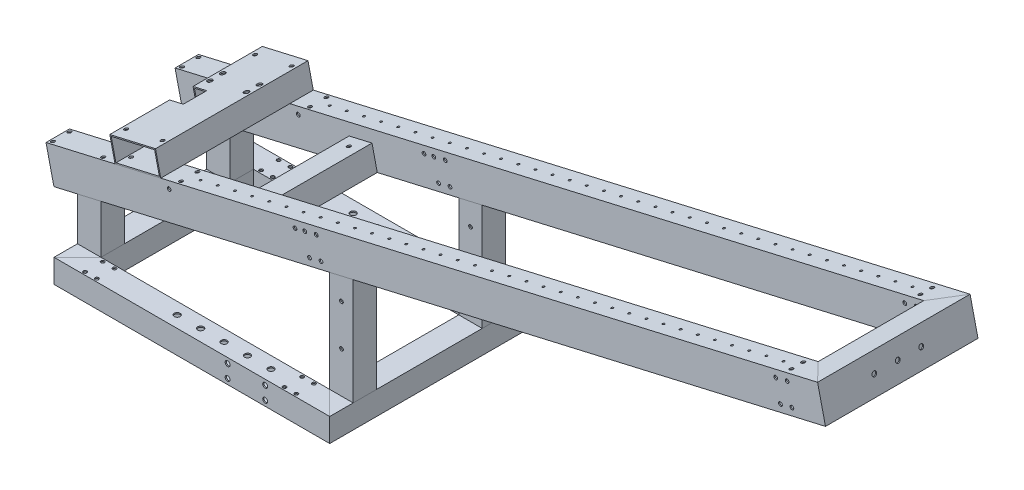
from build123d import *

# Parameters (mm, degrees)
F_20_X_20_X_2_1_DEPTH      = 165.142135624
F_20_X_20_X_2_1_DEPTH_BACK = 15.142135624
SKETCH1_W                  = 20
SKETCH1_H                  = 20
SKETCH1_W_2                = 18
SKETCH1_H_2                = 18
SKETCH1_ON_SEGMENT_2_W     = 20
SKETCH1_ON_SEGMENT_2_H     = 20
SKETCH1_ON_SEGMENT_2_W_2   = 18
SKETCH1_ON_SEGMENT_2_H_2   = 18
F_20_X_20_X_2_1_2_DEPTH    = 245.284271247
SKETCH1_ON_SEGMENT_3_W     = 20
SKETCH1_ON_SEGMENT_3_H     = 20
SKETCH1_ON_SEGMENT_3_W_2   = 18
SKETCH1_ON_SEGMENT_3_H_2   = 18
F_20_X_20_X_2_1_3_DEPTH    = 180.284271247
SKETCH1_ON_SEGMENT_4_W     = 20
SKETCH1_ON_SEGMENT_4_H     = 20
SKETCH1_ON_SEGMENT_4_W_2   = 18
SKETCH1_ON_SEGMENT_4_H_2   = 18
F_20_X_20_X_2_1_4_DEPTH    = 245.284271247
SKETCH1_ON_SEGMENT_5_W     = 20
SKETCH1_ON_SEGMENT_5_H     = 20
SKETCH1_ON_SEGMENT_5_W_2   = 18
SKETCH1_ON_SEGMENT_5_H_2   = 18
F_20_X_20_X_2_1_5_DEPTH    = 65.463338908
SKETCH1_ON_SEGMENT_6_W     = 20
SKETCH1_ON_SEGMENT_6_H     = 20
SKETCH1_ON_SEGMENT_6_W_2   = 18
SKETCH1_ON_SEGMENT_6_H_2   = 18
F_20_X_20_X_2_1_6_DEPTH    = 115.1
SKETCH1_ON_SEGMENT_7_W     = 20
SKETCH1_ON_SEGMENT_7_H     = 20
SKETCH1_ON_SEGMENT_7_W_2   = 18
SKETCH1_ON_SEGMENT_7_H_2   = 18
F_20_X_20_X_2_1_7_DEPTH    = 115.1
SKETCH1_ON_SEGMENT_8_W     = 20
SKETCH1_ON_SEGMENT_8_H     = 20
SKETCH1_ON_SEGMENT_8_W_2   = 18
SKETCH1_ON_SEGMENT_8_H_2   = 18
F_20_X_20_X_2_1_8_DEPTH    = 65.463338908
SKETCH12_W                 = 30
SKETCH12_H                 = 20
SKETCH12_W_2               = 28
SKETCH12_H_2               = 18
F_20_X_20_X_2_22_DEPTH     = 684.027756377
SKETCH12_ON_SEGMENT_2_W    = 30
SKETCH12_ON_SEGMENT_2_H    = 20
SKETCH12_ON_SEGMENT_2_W_2  = 28
SKETCH12_ON_SEGMENT_2_H_2  = 18
F_20_X_20_X_2_22_2_DEPTH   = 148.055512755
SKETCH12_ON_SEGMENT_3_W    = 30
SKETCH12_ON_SEGMENT_3_H    = 20
SKETCH12_ON_SEGMENT_3_W_2  = 28
SKETCH12_ON_SEGMENT_3_H_2  = 18
F_20_X_20_X_2_22_3_DEPTH   = 684.027756377
CUT_EXTRUDE_1_REACH        = 700.493
SKETCH_4_R                 = 2
SKETCH_5_R                 = 1.6
SKETCH_5_R_2               = 1
CUT_EXTRUDE_2_DEPTH        = 30
CUT_EXTRUDE_START          = -20
SKETCH_6_R                 = 1.5
CUT_EXTRUDE_3_DEPTH        = 20
EXTRUDE_1_DEPTH            = 90
SKETCH_15_R                = 1.6
CUT_EXTRUDE_9_DEPTH        = 683.795673711
SKETCH_16_R                = 1.6
EXTRUDE_5_DEPTH            = 20
CUT_EXTRUDE_10_DEPTH       = 683.795673711
SKETCH_19_R                = 1.6
CUT_EXTRUDE_11_DEPTH       = 668.222784448
SKETCH_21_R                = 2.1
CUT_EXTRUDE_16_DEPTH       = 688.466313384
SKETCH_22_R                = 1.6
CUT_EXTRUDE_17_DEPTH       = 683.795673711
SKETCH_23_R                = 2.5
CUT_EXTRUDE_18_DEPTH       = 20
SKETCH_26_R                = 2.1
CUT_EXTRUDE_19_DEPTH       = 668.515789659
SKETCH_27_R                = 1.6
CUT_EXTRUDE_20_DEPTH       = 683.795673711


with BuildPart() as part:
    # Sketch1 → 方形管 20 X 20 X 2(1) (new, two sides: drawn at the far end of the back side and taken through both)
    with BuildSketch(Plane.XY.offset(-75).offset(-F_20_X_20_X_2_1_DEPTH_BACK)):
        Rectangle(SKETCH1_W, SKETCH1_H)
        Rectangle(SKETCH1_W_2, SKETCH1_H_2, mode=Mode.SUBTRACT)
    extrude(amount=F_20_X_20_X_2_1_DEPTH + F_20_X_20_X_2_1_DEPTH_BACK)

    # 方形管 20 X 20 X 2(1) mitre 1
    split(bisect_by=Plane(origin=(0, 0, -75), x_dir=(0, -1, 0), z_dir=(-0.707106781, 0, 0.707106781)), keep=Keep.TOP)

    # 方形管 20 X 20 X 2(1) mitre 2
    split(bisect_by=Plane(origin=(0, 0, 75), x_dir=(0, -1, 0), z_dir=(-0.707106781, 0, -0.707106781)), keep=Keep.TOP)


with BuildPart() as body_2:
    # Sketch1 on segment 2 (carried to segment 2) → 20 X 20 X 2_1 2 (new body)
    with BuildSketch(Plane(origin=(-15.142135624, 0, 75), x_dir=(0, 0, -1), z_dir=(1, 0, 0))):
        Rectangle(SKETCH1_ON_SEGMENT_2_W, SKETCH1_ON_SEGMENT_2_H)
        Rectangle(SKETCH1_ON_SEGMENT_2_W_2, SKETCH1_ON_SEGMENT_2_H_2, mode=Mode.SUBTRACT)
    extrude(amount=F_20_X_20_X_2_1_2_DEPTH)

    # 20 X 20 X 2_1 2 mitre 1
    split(bisect_by=Plane(origin=(0, 0, 75), x_dir=(0, 1, 0), z_dir=(0.707106781, 0, 0.707106781)), keep=Keep.TOP)

    # 20 X 20 X 2_1 2 mitre 2
    split(bisect_by=Plane(origin=(215, 0, 75), x_dir=(0, -1, 0), z_dir=(-0.707106781, 0, 0.707106781)), keep=Keep.TOP)


with BuildPart() as body_3:
    # Sketch1 on segment 3 (carried to segment 3) → 20 X 20 X 2_1 3 (new body)
    with BuildSketch(Plane(origin=(215, 0, 90.142135624), x_dir=(-1, 0, 0), z_dir=(0, 0, -1))):
        Rectangle(SKETCH1_ON_SEGMENT_3_W, SKETCH1_ON_SEGMENT_3_H)
        Rectangle(SKETCH1_ON_SEGMENT_3_W_2, SKETCH1_ON_SEGMENT_3_H_2, mode=Mode.SUBTRACT)
    extrude(amount=F_20_X_20_X_2_1_3_DEPTH)

    # 20 X 20 X 2_1 3 mitre 1
    split(bisect_by=Plane(origin=(215, 0, 75), x_dir=(0, 1, 0), z_dir=(0.707106781, 0, -0.707106781)), keep=Keep.TOP)

    # 20 X 20 X 2_1 3 mitre 2
    split(bisect_by=Plane(origin=(215, 0, -75), x_dir=(0, 1, 0), z_dir=(0.707106781, 0, 0.707106781)), keep=Keep.TOP)


with BuildPart() as body_4:
    # Sketch1 on segment 4 (carried to segment 4) → 20 X 20 X 2_1 4 (new body)
    with BuildSketch(Plane(origin=(230.142135624, 0, -75), x_dir=(0, 0, 1), z_dir=(-1, 0, 0))):
        Rectangle(SKETCH1_ON_SEGMENT_4_W, SKETCH1_ON_SEGMENT_4_H)
        Rectangle(SKETCH1_ON_SEGMENT_4_W_2, SKETCH1_ON_SEGMENT_4_H_2, mode=Mode.SUBTRACT)
    extrude(amount=F_20_X_20_X_2_1_4_DEPTH)

    # 20 X 20 X 2_1 4 mitre 1
    split(bisect_by=Plane(origin=(215, 0, -75), x_dir=(0, -1, 0), z_dir=(-0.707106781, 0, -0.707106781)), keep=Keep.TOP)

    # 20 X 20 X 2_1 4 mitre 2
    split(bisect_by=Plane(origin=(0, 0, -75), x_dir=(0, 1, 0), z_dir=(0.707106781, 0, -0.707106781)), keep=Keep.TOP)


with BuildPart() as body_5:
    # Sketch1 on segment 5 (carried to segment 5) → 20 X 20 X 2_1 5 (new body)
    with BuildSketch(Plane(origin=(0, 64.463338908, 55), x_dir=(1, 0, 0), z_dir=(0, -1, 0))):
        Rectangle(SKETCH1_ON_SEGMENT_5_W, SKETCH1_ON_SEGMENT_5_H)
        Rectangle(SKETCH1_ON_SEGMENT_5_W_2, SKETCH1_ON_SEGMENT_5_H_2, mode=Mode.SUBTRACT)
    extrude(amount=F_20_X_20_X_2_1_5_DEPTH)

    # 20 X 20 X 2_1 5 mitre 1
    split(bisect_by=Plane(origin=(0, 10, 55), x_dir=(-1, 0, 0), z_dir=(0, 1, 0)), keep=Keep.TOP)

    # Weld Trim 4 9
    split(bisect_by=Plane(origin=(293.912366139, 116.923793611, 55.050125313), x_dir=(0.974370065, 0.224951054, 0), z_dir=(0.224951054, -0.974370065, 0)), keep=Keep.TOP)


with BuildPart() as body_6:
    # Sketch1 on segment 6 (carried to segment 6) → 20 X 20 X 2_1 6 (new body)
    with BuildSketch(Plane(origin=(215, -1, 55), x_dir=(1, 0, 0), z_dir=(0, 1, 0))):
        Rectangle(SKETCH1_ON_SEGMENT_6_W, SKETCH1_ON_SEGMENT_6_H)
        Rectangle(SKETCH1_ON_SEGMENT_6_W_2, SKETCH1_ON_SEGMENT_6_H_2, mode=Mode.SUBTRACT)
    extrude(amount=F_20_X_20_X_2_1_6_DEPTH)

    # 20 X 20 X 2_1 6 mitre 1
    split(bisect_by=Plane(origin=(215, 10, 55), x_dir=(-1, 0, 0), z_dir=(0, 1, 0)), keep=Keep.TOP)

    # Weld Trim 4 9
    split(bisect_by=Plane(origin=(293.912366139, 116.923793611, 55.050125313), x_dir=(0.974370065, 0.224951054, 0), z_dir=(0.224951054, -0.974370065, 0)), keep=Keep.TOP)


with BuildPart() as body_7:
    # Sketch1 on segment 7 (carried to segment 7) → 20 X 20 X 2_1 7 (new body)
    with BuildSketch(Plane(origin=(215, -1, -55), x_dir=(1, 0, 0), z_dir=(0, 1, 0))):
        Rectangle(SKETCH1_ON_SEGMENT_7_W, SKETCH1_ON_SEGMENT_7_H)
        Rectangle(SKETCH1_ON_SEGMENT_7_W_2, SKETCH1_ON_SEGMENT_7_H_2, mode=Mode.SUBTRACT)
    extrude(amount=F_20_X_20_X_2_1_7_DEPTH)

    # 20 X 20 X 2_1 7 mitre 1
    split(bisect_by=Plane(origin=(215, 10, -55), x_dir=(-1, 0, 0), z_dir=(0, 1, 0)), keep=Keep.TOP)

    # Weld Trim 5 9
    split(bisect_by=Plane(origin=(293.912366106, 116.923793742, -55.050125313), x_dir=(0.974370065, 0.224951054, 0), z_dir=(0.224951054, -0.974370065, 0)), keep=Keep.TOP)


with BuildPart() as body_8:
    # Sketch1 on segment 8 (carried to segment 8) → 20 X 20 X 2_1 8 (new body)
    with BuildSketch(Plane(origin=(0, 64.463338908, -55), x_dir=(1, 0, 0), z_dir=(0, -1, 0))):
        Rectangle(SKETCH1_ON_SEGMENT_8_W, SKETCH1_ON_SEGMENT_8_H)
        Rectangle(SKETCH1_ON_SEGMENT_8_W_2, SKETCH1_ON_SEGMENT_8_H_2, mode=Mode.SUBTRACT)
    extrude(amount=F_20_X_20_X_2_1_8_DEPTH)

    # 20 X 20 X 2_1 8 mitre 1
    split(bisect_by=Plane(origin=(0, 10, -55), x_dir=(-1, 0, 0), z_dir=(0, 1, 0)), keep=Keep.TOP)

    # Weld Trim 5 9
    split(bisect_by=Plane(origin=(293.912366106, 116.923793742, -55.050125313), x_dir=(0.974370065, 0.224951054, 0), z_dir=(0.224951054, -0.974370065, 0)), keep=Keep.TOP)


with BuildPart() as body_9:
    # Sketch12 → 方形管 20 X 20 X 2(22) (new body)
    with BuildSketch(Plane(origin=(-33.46436652, 56.737481142, 55), x_dir=(0.22495105434386553, -0.9743700647852351, 0), z_dir=(0.9743700647852351, 0.22495105434386553, 0))):
        Rectangle(SKETCH12_W, SKETCH12_H)
        Rectangle(SKETCH12_W_2, SKETCH12_H_2, mode=Mode.SUBTRACT)
    extrude(amount=F_20_X_20_X_2_22_DEPTH)

    # 方形管 20 X 20 X 2(22) mitre 1
    split(bisect_by=Plane(origin=(614.491726562, 206.329932281, 55), x_dir=(0.224951054, -0.974370065, 0), z_dir=(-0.68898368, -0.159064416, 0.707106781)), keep=Keep.TOP)


with BuildPart() as body_10:
    # Sketch12 on segment 2 (carried to segment 2) → 20 X 20 X 2_22 2 (new body)
    with BuildSketch(Plane(origin=(614.491726562, 206.329932281, 74.027756377), x_dir=(0.224951054, -0.974370065, 0), z_dir=(0, 0, -1))):
        Rectangle(SKETCH12_ON_SEGMENT_2_W, SKETCH12_ON_SEGMENT_2_H)
        Rectangle(SKETCH12_ON_SEGMENT_2_W_2, SKETCH12_ON_SEGMENT_2_H_2, mode=Mode.SUBTRACT)
    extrude(amount=F_20_X_20_X_2_22_2_DEPTH)

    # 20 X 20 X 2_22 2 mitre 1
    split(bisect_by=Plane(origin=(614.491726562, 206.329932281, -55), x_dir=(-0.224951054, 0.974370065, 0), z_dir=(0.68898368, 0.159064416, 0.707106781)), keep=Keep.TOP)

    # 20 X 20 X 2_22 2 mitre 2
    split(bisect_by=Plane(origin=(614.491726562, 206.329932281, 55), x_dir=(-0.224951054, 0.974370065, 0), z_dir=(0.68898368, 0.159064416, -0.707106781)), keep=Keep.TOP)

    # 切除-拉伸1: up to this face of the body (flat: up to its plane)
    cut_extrude_1_end = Plane(body_10.part.faces().sort_by_distance((604.748025913, 204.080421742, 0))[0])
    # 草图4 → 切除-拉伸1 (cut, up to the picked face)
    with BuildSketch(Plane(origin=(638.364861111, 147.378140763, 0), x_dir=(0, 0, -1), z_dir=(0.9743700647852354, 0.22495105434386442, 0)), mode=Mode.PRIVATE) as cut_extrude_1_sk1:
        with Locations(Location((0, 62.811147708, 0), (0, 0, 90))):
            Circle(SKETCH_4_R)
    cut_extrude_1_tool1 = split(extrude(cut_extrude_1_sk1.sketch, amount=-CUT_EXTRUDE_1_REACH, mode=Mode.PRIVATE), bisect_by=cut_extrude_1_end, keep=Keep.BOTH, mode=Mode.PRIVATE)
    # 草图4 → 切除-拉伸1 (cut, up to the picked face)
    with BuildSketch(Plane(origin=(638.364861111, 147.378140763, 0), x_dir=(0, 0, -1), z_dir=(0.9743700647852354, 0.22495105434386442, 0)), mode=Mode.PRIVATE) as cut_extrude_1_sk2:
        with Locations(Location((20, 62.811147708, 0), (0, 0, 90))):
            Circle(SKETCH_4_R)
    cut_extrude_1_tool2 = split(extrude(cut_extrude_1_sk2.sketch, amount=-CUT_EXTRUDE_1_REACH, mode=Mode.PRIVATE), bisect_by=cut_extrude_1_end, keep=Keep.BOTH, mode=Mode.PRIVATE)
    # 草图4 → 切除-拉伸1 (cut, up to the picked face)
    with BuildSketch(Plane(origin=(638.364861111, 147.378140763, 0), x_dir=(0, 0, -1), z_dir=(0.9743700647852354, 0.22495105434386442, 0)), mode=Mode.PRIVATE) as cut_extrude_1_sk3:
        with Locations(Location((-20, 62.811147708, 0), (0, 0, 270))):
            Circle(SKETCH_4_R)
    cut_extrude_1_tool3 = split(extrude(cut_extrude_1_sk3.sketch, amount=-CUT_EXTRUDE_1_REACH, mode=Mode.PRIVATE), bisect_by=cut_extrude_1_end, keep=Keep.BOTH, mode=Mode.PRIVATE)
    add(cut_extrude_1_tool1.solids().sort_by(Axis((624.235427, 208.579443, 0), (-0.9743700647852354, -0.22495105434386442, 0)))[0], mode=Mode.SUBTRACT)
    add(cut_extrude_1_tool2.solids().sort_by(Axis((624.235427, 208.579443, -20), (-0.9743700647852354, -0.22495105434386442, 0)))[0], mode=Mode.SUBTRACT)
    add(cut_extrude_1_tool3.solids().sort_by(Axis((624.235427, 208.579443, 20), (-0.9743700647852354, -0.22495105434386442, 0)))[0], mode=Mode.SUBTRACT)


with BuildPart() as body_11:
    # Sketch12 on segment 3 (carried to segment 3) → 20 X 20 X 2_22 3 (new body)
    with BuildSketch(Plane(origin=(633.031802776, 210.61024614, -55), x_dir=(0.224951054, -0.974370065, 0), z_dir=(-0.974370065, -0.224951054, 0))):
        Rectangle(SKETCH12_ON_SEGMENT_3_W, SKETCH12_ON_SEGMENT_3_H)
        Rectangle(SKETCH12_ON_SEGMENT_3_W_2, SKETCH12_ON_SEGMENT_3_H_2, mode=Mode.SUBTRACT)
    extrude(amount=F_20_X_20_X_2_22_3_DEPTH)

    # 20 X 20 X 2_22 3 mitre 1
    split(bisect_by=Plane(origin=(614.491726562, 206.329932281, -55), x_dir=(0.224951054, -0.974370065, 0), z_dir=(-0.68898368, -0.159064416, -0.707106781)), keep=Keep.TOP)


with BuildPart() as cut_extrude_2_tool:
    # 草图5 → 切除-拉伸2 (new body)
    with BuildSketch(Plane(origin=(-17.503699717, 75.816853033, 0), x_dir=(0.9743700647852352, 0.22495105434386561, 0), z_dir=(-0.22495105434386561, 0.9743700647852352, 0))):
        with Locations(Location((627.156479229, 50, 0), (0, 0, 180))):
            Circle(SKETCH_5_R)
        with Locations(Location((627.156479229, 60, 0), (0, 0, 180))):
            Circle(SKETCH_5_R)
        with Locations(Location((615.156479229, 55, 0), (0, 0, 180))):
            Circle(SKETCH_5_R_2)
        with Locations(Location((600.156479229, 55, 0), (0, 0, 180))):
            Circle(SKETCH_5_R_2)
        with Locations(Location((585.156479229, 55, 0), (0, 0, 180))):
            Circle(SKETCH_5_R_2)
        with Locations(Location((570.156479229, 55, 0), (0, 0, 180))):
            Circle(SKETCH_5_R_2)
        with Locations(Location((555.156479229, 55, 0), (0, 0, 180))):
            Circle(SKETCH_5_R_2)
        with Locations(Location((540.156479229, 55, 0), (0, 0, 180))):
            Circle(SKETCH_5_R_2)
        with Locations(Location((525.156479229, 55, 0), (0, 0, 180))):
            Circle(SKETCH_5_R_2)
        with Locations(Location((510.156479229, 55, 0), (0, 0, 180))):
            Circle(SKETCH_5_R_2)
        with Locations(Location((495.156479229, 55, 0), (0, 0, 180))):
            Circle(SKETCH_5_R_2)
        with Locations(Location((480.156479229, 55, 0), (0, 0, 180))):
            Circle(SKETCH_5_R_2)
        with Locations(Location((465.156479229, 55, 0), (0, 0, 180))):
            Circle(SKETCH_5_R_2)
        with Locations(Location((450.156479229, 55, 0), (0, 0, 180))):
            Circle(SKETCH_5_R_2)
        with Locations(Location((435.156479229, 55, 0), (0, 0, 180))):
            Circle(SKETCH_5_R_2)
        with Locations(Location((420.156479229, 55, 0), (0, 0, 180))):
            Circle(SKETCH_5_R_2)
        with Locations(Location((405.156479229, 55, 0), (0, 0, 180))):
            Circle(SKETCH_5_R_2)
        with Locations(Location((390.156479229, 55, 0), (0, 0, 180))):
            Circle(SKETCH_5_R_2)
        with Locations(Location((375.156479229, 55, 0), (0, 0, 180))):
            Circle(SKETCH_5_R_2)
        with Locations(Location((360.156479229, 55, 0), (0, 0, 180))):
            Circle(SKETCH_5_R_2)
        with Locations(Location((345.156479229, 55, 0), (0, 0, 180))):
            Circle(SKETCH_5_R_2)
        with Locations(Location((330.156479229, 55, 0), (0, 0, 180))):
            Circle(SKETCH_5_R_2)
        with Locations(Location((315.156479229, 55, 0), (0, 0, 180))):
            Circle(SKETCH_5_R_2)
        with Locations(Location((300.156479229, 55, 0), (0, 0, 180))):
            Circle(SKETCH_5_R_2)
        with Locations(Location((285.156479229, 55, 0), (0, 0, 180))):
            Circle(SKETCH_5_R_2)
        with Locations(Location((270.156479229, 55, 0), (0, 0, 180))):
            Circle(SKETCH_5_R_2)
        with Locations(Location((255.156479229, 55, 0), (0, 0, 180))):
            Circle(SKETCH_5_R_2)
        with Locations(Location((240.156479229, 55, 0), (0, 0, 180))):
            Circle(SKETCH_5_R_2)
        with Locations(Location((225.156479229, 55, 0), (0, 0, 180))):
            Circle(SKETCH_5_R_2)
        with Locations(Location((210.156479229, 55, 0), (0, 0, 180))):
            Circle(SKETCH_5_R_2)
        with Locations(Location((195.156479229, 55, 0), (0, 0, 180))):
            Circle(SKETCH_5_R_2)
        with Locations(Location((180.156479229, 55, 0), (0, 0, 180))):
            Circle(SKETCH_5_R_2)
        with Locations(Location((165.156479229, 55, 0), (0, 0, 180))):
            Circle(SKETCH_5_R_2)
        with Locations(Location((150.156479229, 55, 0), (0, 0, 180))):
            Circle(SKETCH_5_R_2)
        with Locations(Location((135.156479229, 55, 0), (0, 0, 180))):
            Circle(SKETCH_5_R_2)
        with Locations(Location((120.156479229, 55, 0), (0, 0, 180))):
            Circle(SKETCH_5_R_2)
        with Locations(Location((105.156479229, 55, 0), (0, 0, 180))):
            Circle(SKETCH_5_R_2)
        with Locations(Location((-16.843520771, 48, 0), (0, 0, 180))):
            Circle(SKETCH_5_R)
        with Locations(Location((27.156479229, 48, 0), (0, 0, 180))):
            Circle(SKETCH_5_R)
        with Locations(Location((44.556479229, 55, 0), (0, 0, 180))):
            Circle(SKETCH_5_R)
        with Locations(Location((76.556479229, 55, 0), (0, 0, 180))):
            Circle(SKETCH_5_R)
        with Locations(Location((95.160238641, 48, 0), (0, 0, 180))):
            Circle(SKETCH_5_R)
        with Locations(Location((-16.843520771, 62, 0), (0, 0, 180))):
            Circle(SKETCH_5_R)
        with Locations(Location((27.156479229, 62, 0), (0, 0, 180))):
            Circle(SKETCH_5_R)
        with Locations(Location((95.160238641, 62, 0), (0, 0, 180))):
            Circle(SKETCH_5_R)
        with Locations(Location((95.160238641, -62, 0), (0, 0, 180))):
            Circle(SKETCH_5_R)
        with Locations(Location((27.156479229, -62, 0), (0, 0, 180))):
            Circle(SKETCH_5_R)
        with Locations(Location((-16.843520771, -62, 0), (0, 0, 180))):
            Circle(SKETCH_5_R)
        with Locations(Location((95.160238641, -48, 0), (0, 0, 180))):
            Circle(SKETCH_5_R)
        with Locations(Location((76.556479229, -55, 0), (0, 0, 180))):
            Circle(SKETCH_5_R)
        with Locations(Location((44.556479229, -55, 0), (0, 0, 180))):
            Circle(SKETCH_5_R)
        with Locations(Location((27.156479229, -48, 0), (0, 0, 180))):
            Circle(SKETCH_5_R)
        with Locations(Location((-16.843520771, -48, 0), (0, 0, 180))):
            Circle(SKETCH_5_R)
        with Locations(Location((105.156479229, -55, 0), (0, 0, 180))):
            Circle(SKETCH_5_R_2)
        with Locations(Location((120.156479229, -55, 0), (0, 0, 180))):
            Circle(SKETCH_5_R_2)
        with Locations(Location((135.156479229, -55, 0), (0, 0, 180))):
            Circle(SKETCH_5_R_2)
        with Locations(Location((150.156479229, -55, 0), (0, 0, 180))):
            Circle(SKETCH_5_R_2)
        with Locations(Location((165.156479229, -55, 0), (0, 0, 180))):
            Circle(SKETCH_5_R_2)
        with Locations(Location((180.156479229, -55, 0), (0, 0, 180))):
            Circle(SKETCH_5_R_2)
        with Locations(Location((195.156479229, -55, 0), (0, 0, 180))):
            Circle(SKETCH_5_R_2)
        with Locations(Location((210.156479229, -55, 0), (0, 0, 180))):
            Circle(SKETCH_5_R_2)
        with Locations(Location((225.156479229, -55, 0), (0, 0, 180))):
            Circle(SKETCH_5_R_2)
        with Locations(Location((240.156479229, -55, 0), (0, 0, 180))):
            Circle(SKETCH_5_R_2)
        with Locations(Location((255.156479229, -55, 0), (0, 0, 180))):
            Circle(SKETCH_5_R_2)
        with Locations(Location((270.156479229, -55, 0), (0, 0, 180))):
            Circle(SKETCH_5_R_2)
        with Locations(Location((285.156479229, -55, 0), (0, 0, 180))):
            Circle(SKETCH_5_R_2)
        with Locations(Location((300.156479229, -55, 0), (0, 0, 180))):
            Circle(SKETCH_5_R_2)
        with Locations(Location((315.156479229, -55, 0), (0, 0, 180))):
            Circle(SKETCH_5_R_2)
        with Locations(Location((330.156479229, -55, 0), (0, 0, 180))):
            Circle(SKETCH_5_R_2)
        with Locations(Location((345.156479229, -55, 0), (0, 0, 180))):
            Circle(SKETCH_5_R_2)
        with Locations(Location((360.156479229, -55, 0), (0, 0, 180))):
            Circle(SKETCH_5_R_2)
        with Locations(Location((375.156479229, -55, 0), (0, 0, 180))):
            Circle(SKETCH_5_R_2)
        with Locations(Location((390.156479229, -55, 0), (0, 0, 180))):
            Circle(SKETCH_5_R_2)
        with Locations(Location((405.156479229, -55, 0), (0, 0, 180))):
            Circle(SKETCH_5_R_2)
        with Locations(Location((420.156479229, -55, 0), (0, 0, 180))):
            Circle(SKETCH_5_R_2)
        with Locations(Location((435.156479229, -55, 0), (0, 0, 180))):
            Circle(SKETCH_5_R_2)
        with Locations(Location((450.156479229, -55, 0), (0, 0, 180))):
            Circle(SKETCH_5_R_2)
        with Locations(Location((465.156479229, -55, 0), (0, 0, 180))):
            Circle(SKETCH_5_R_2)
        with Locations(Location((480.156479229, -55, 0), (0, 0, 180))):
            Circle(SKETCH_5_R_2)
        with Locations(Location((495.156479229, -55, 0), (0, 0, 180))):
            Circle(SKETCH_5_R_2)
        with Locations(Location((510.156479229, -55, 0), (0, 0, 180))):
            Circle(SKETCH_5_R_2)
        with Locations(Location((525.156479229, -55, 0), (0, 0, 180))):
            Circle(SKETCH_5_R_2)
        with Locations(Location((540.156479229, -55, 0), (0, 0, 180))):
            Circle(SKETCH_5_R_2)
        with Locations(Location((555.156479229, -55, 0), (0, 0, 180))):
            Circle(SKETCH_5_R_2)
        with Locations(Location((570.156479229, -55, 0), (0, 0, 180))):
            Circle(SKETCH_5_R_2)
        with Locations(Location((585.156479229, -55, 0), (0, 0, 180))):
            Circle(SKETCH_5_R_2)
        with Locations(Location((600.156479229, -55, 0), (0, 0, 180))):
            Circle(SKETCH_5_R_2)
        with Locations(Location((615.156479229, -55, 0), (0, 0, 180))):
            Circle(SKETCH_5_R_2)
        with Locations(Location((627.156479229, -60, 0), (0, 0, 180))):
            Circle(SKETCH_5_R)
        with Locations(Location((627.156479229, -50, 0), (0, 0, 180))):
            Circle(SKETCH_5_R)
    extrude(amount=-CUT_EXTRUDE_2_DEPTH)


with BuildPart() as body_9_1:
    add(body_9.part)

    # 切除-拉伸2: cut by cut_extrude_2_tool
    add(cut_extrude_2_tool.part, mode=Mode.SUBTRACT)


with BuildPart() as body_11_1:
    add(body_11.part)

    # 切除-拉伸2: cut by cut_extrude_2_tool
    add(cut_extrude_2_tool.part, mode=Mode.SUBTRACT)


with BuildPart() as cut_extrude_3_tool:
    # 草图6 → 切除-拉伸3 (new body)
    with BuildSketch(Plane.XZ.offset(10).offset(CUT_EXTRUDE_START)):
        with Locations(Location((24, -82.5, 0), (0, 0, 270))):
            Circle(SKETCH_6_R)
        with Locations(Location((14, -82.5, 0), (0, 0, 270))):
            Circle(SKETCH_6_R)
        with Locations(Location((14, -67.5, 0), (0, 0, 90))):
            Circle(SKETCH_6_R)
        with Locations(Location((24, -67.5, 0), (0, 0, 90))):
            Circle(SKETCH_6_R)
        with Locations(Location((194, -67.5, 0), (0, 0, 90))):
            Circle(SKETCH_6_R)
        with Locations(Location((194, -82.5, 0), (0, 0, 270))):
            Circle(SKETCH_6_R)
        with Locations(Location((184, -82.5, 0), (0, 0, 270))):
            Circle(SKETCH_6_R)
        with Locations(Location((184, -67.5, 0), (0, 0, 90))):
            Circle(SKETCH_6_R)
        with Locations(Location((184, 67.5, 0), (0, 0, 270))):
            Circle(SKETCH_6_R)
        with Locations(Location((184, 82.5, 0), (0, 0, 90))):
            Circle(SKETCH_6_R)
        with Locations(Location((194, 82.5, 0), (0, 0, 90))):
            Circle(SKETCH_6_R)
        with Locations(Location((194, 67.5, 0), (0, 0, 270))):
            Circle(SKETCH_6_R)
        with Locations(Location((24, 67.5, 0), (0, 0, 270))):
            Circle(SKETCH_6_R)
        with Locations(Location((14, 67.5, 0), (0, 0, 270))):
            Circle(SKETCH_6_R)
        with Locations(Location((14, 82.5, 0), (0, 0, 90))):
            Circle(SKETCH_6_R)
        with Locations(Location((24, 82.5, 0), (0, 0, 90))):
            Circle(SKETCH_6_R)
    extrude(amount=CUT_EXTRUDE_3_DEPTH)


with BuildPart() as body_2_1:
    add(body_2.part)

    # 切除-拉伸3: cut by cut_extrude_3_tool
    add(cut_extrude_3_tool.part, mode=Mode.SUBTRACT)


with BuildPart() as body_4_1:
    add(body_4.part)

    # 切除-拉伸3: cut by cut_extrude_3_tool
    add(cut_extrude_3_tool.part, mode=Mode.SUBTRACT)


with BuildPart() as body_12:
    # 草图9 → 凸台-拉伸1 (new body)
    with BuildSketch(Plane.XY.offset(-45)):
        Polygon((111.566387926, 95.351989618), (131.053789222, 99.851010705), (135.552810308, 80.363609409), (116.065409013, 75.864588322), align=None)
        Polygon((112.765709045, 94.602570607), (130.304370211, 98.651689586), (134.353489189, 81.113028419), (116.814828023, 77.063909441), align=None, mode=Mode.SUBTRACT)
    extrude(amount=EXTRUDE_1_DEPTH)

    # 草图19 → 切除-拉伸11 (cut, through all)
    with BuildSketch(Plane(origin=(-15.254189173, 66.073152385, 0), x_dir=(0.9743700647852352, 0.22495105434386517, 0), z_dir=(-0.22495105434386517, 0.9743700647852352, 0))):
        with Locations(Location((140.156479229, 35, 0), (0, 0, 180))):
            Circle(SKETCH_19_R)
        with Locations(Location((140.156479229, -35, 0), (0, 0, 180))):
            Circle(SKETCH_19_R)
    extrude(amount=-CUT_EXTRUDE_11_DEPTH, mode=Mode.SUBTRACT)


with BuildPart() as cut_extrude_9_tool:
    # 草图15 → 切除-拉伸9 (new, through all)
    with BuildSketch(Plane.XY.offset(65)):
        with Locations((594.928505907, 211.050143886)):
            Circle(SKETCH_15_R)
        with Locations(Location((598.977624885, 193.51148272, 0), (0, 0, 180))):
            Circle(SKETCH_15_R)
        with Locations((589.233924237, 191.261972176)):
            Circle(SKETCH_15_R)
        with Locations(Location((585.184805259, 208.800633342, 0), (0, 0, 180))):
            Circle(SKETCH_15_R)
        with Locations((183.744338567, 116.120798953)):
            Circle(SKETCH_15_R)
        with Locations((193.488039215, 118.370309496)):
            Circle(SKETCH_15_R)
        with Locations(Location((197.537158193, 100.83164833, 0), (0, 0, 180))):
            Circle(SKETCH_15_R)
        with Locations(Location((187.793457546, 98.582137787, 0), (0, 0, 180))):
            Circle(SKETCH_15_R)
    extrude(amount=-CUT_EXTRUDE_9_DEPTH)


with BuildPart() as body_9_2:
    add(body_9_1.part)

    # 切除-拉伸9: cut by cut_extrude_9_tool
    add(cut_extrude_9_tool.part, mode=Mode.SUBTRACT)


with BuildPart() as body_11_2:
    add(body_11_1.part)

    # 切除-拉伸9: cut by cut_extrude_9_tool
    add(cut_extrude_9_tool.part, mode=Mode.SUBTRACT)


with BuildPart() as body_13:
    # 草图16 → 凸台-拉伸5 (new body)
    with BuildSketch(Plane(origin=(-17.503699717, 75.816853033, 0), x_dir=(0.9743700647852352, 0.22495105434386548, 0), z_dir=(-0.22495105434386548, 0.9743700647852352, 0))):
        Polygon((80.556479229, -65), (80.556479229, 65), (40.556479229, 65), (40.556479229, 6), (52.556479229, 6), (52.556479229, -14), (40.556479229, -14), (40.556479229, -65), align=None)
        with Locations(Location((44.556479229, -55, 0), (0, 0, 180))):
            Circle(SKETCH_16_R, mode=Mode.SUBTRACT)
        with Locations(Location((76.556479229, -55, 0), (0, 0, 180))):
            Circle(SKETCH_16_R, mode=Mode.SUBTRACT)
        with Locations(Location((44.556479229, 55, 0), (0, 0, 180))):
            Circle(SKETCH_16_R, mode=Mode.SUBTRACT)
        with Locations(Location((76.556479229, 55, 0), (0, 0, 180))):
            Circle(SKETCH_16_R, mode=Mode.SUBTRACT)
    extrude(amount=EXTRUDE_5_DEPTH)

    # 草图17 → 切除-拉伸10 (cut, through all)
    with BuildSketch(Plane(origin=(0, 0, -65), x_dir=(-1, 0, 0), z_dir=(0, 0, -1))):
        Polygon((-18.71361961, 103.678058082), (-55.739682072, 112.226198147), (-59.78880105, 94.687536981), (-22.762738588, 86.139396916), align=None)
    extrude(amount=-CUT_EXTRUDE_10_DEPTH, mode=Mode.SUBTRACT)

    # 草图26 → 切除-拉伸19 (cut, through all)
    with BuildSketch(Plane(origin=(-22.002720804, 95.304254329, 0), x_dir=(0.9743700647852351, 0.2249510543438655, 0), z_dir=(-0.2249510543438655, 0.9743700647852351, 0))):
        with Locations(Location((76.556479229, 27.5, 0), (0, 0, 180))):
            Circle(SKETCH_26_R)
        with Locations(Location((76.556479229, 16.5, 0), (0, 0, 180))):
            Circle(SKETCH_26_R)
        with Locations(Location((44.556479229, 16.5, 0), (0, 0, 180))):
            Circle(SKETCH_26_R)
        with Locations(Location((44.556479229, 27.5, 0), (0, 0, 180))):
            Circle(SKETCH_26_R)
    extrude(amount=-CUT_EXTRUDE_19_DEPTH, mode=Mode.SUBTRACT)


with BuildPart() as cut_extrude_16_tool:
    # 草图21 → 切除-拉伸16 (new, through all)
    with BuildSketch(Plane(origin=(0, 0, -85), x_dir=(-1, 0, 0), z_dir=(0, 0, -1))):
        with Locations(Location((-170, -5.5, 0), (0, 0, 90))):
            Circle(SKETCH_21_R)
        with Locations(Location((-138, -5.5, 0), (0, 0, 90))):
            Circle(SKETCH_21_R)
        with Locations(Location((-138, 5.5, 0), (0, 0, 180))):
            Circle(SKETCH_21_R)
        with Locations(Location((-170, 5.5, 0), (0, 0, 180))):
            Circle(SKETCH_21_R)
    extrude(amount=-CUT_EXTRUDE_16_DEPTH)


with BuildPart() as body_2_2:
    add(body_2_1.part)

    # 切除-拉伸16: cut by cut_extrude_16_tool
    add(cut_extrude_16_tool.part, mode=Mode.SUBTRACT)


with BuildPart() as body_4_2:
    add(body_4_1.part)

    # 切除-拉伸16: cut by cut_extrude_16_tool
    add(cut_extrude_16_tool.part, mode=Mode.SUBTRACT)


with BuildPart() as cut_extrude_17_tool:
    # 草图22 → 切除-拉伸17 (new, through all)
    with BuildSketch(Plane.XY.offset(65)):
        with Locations((68.184048884, 89.441603908)):
            Circle(SKETCH_22_R)
        with Locations((175.36475601, 114.186219885)):
            Circle(SKETCH_22_R)
    extrude(amount=-CUT_EXTRUDE_17_DEPTH)


with BuildPart() as body_9_3:
    add(body_9_2.part)

    # 切除-拉伸17: cut by cut_extrude_17_tool
    add(cut_extrude_17_tool.part, mode=Mode.SUBTRACT)


with BuildPart() as body_11_3:
    add(body_11_2.part)

    # 切除-拉伸17: cut by cut_extrude_17_tool
    add(cut_extrude_17_tool.part, mode=Mode.SUBTRACT)


with BuildPart() as cut_extrude_18_tool:
    # 草图23 → 切除-拉伸18 (new body)
    with BuildSketch(Plane.XZ.offset(10).offset(CUT_EXTRUDE_START)):
        with Locations(Location((165, 75, 0), (0, 0, 270))):
            Circle(SKETCH_23_R)
        with Locations(Location((145, 75, 0), (0, 0, 270))):
            Circle(SKETCH_23_R)
        with Locations(Location((125, 75, 0), (0, 0, 270))):
            Circle(SKETCH_23_R)
        with Locations(Location((105, 75, 0), (0, 0, 270))):
            Circle(SKETCH_23_R)
        with Locations(Location((85, 75, 0), (0, 0, 270))):
            Circle(SKETCH_23_R)
        with Locations(Location((85, -75, 0), (0, 0, 270))):
            Circle(SKETCH_23_R)
        with Locations(Location((105, -75, 0), (0, 0, 270))):
            Circle(SKETCH_23_R)
        with Locations(Location((125, -75, 0), (0, 0, 270))):
            Circle(SKETCH_23_R)
        with Locations(Location((145, -75, 0), (0, 0, 270))):
            Circle(SKETCH_23_R)
        with Locations(Location((165, -75, 0), (0, 0, 270))):
            Circle(SKETCH_23_R)
    extrude(amount=CUT_EXTRUDE_18_DEPTH)


with BuildPart() as body_2_3:
    add(body_2_2.part)

    # 切除-拉伸18: cut by cut_extrude_18_tool
    add(cut_extrude_18_tool.part, mode=Mode.SUBTRACT)


with BuildPart() as body_4_3:
    add(body_4_2.part)

    # 切除-拉伸18: cut by cut_extrude_18_tool
    add(cut_extrude_18_tool.part, mode=Mode.SUBTRACT)


with BuildPart() as cut_extrude_20_tool:
    # 草图27 → 切除-拉伸20 (new, through all)
    with BuildSketch(Plane.XY.offset(65)):
        with Locations(Location((215, 45, 0), (0, 0, 90))):
            Circle(SKETCH_27_R)
        with Locations(Location((215, 80, 0), (0, 0, 90))):
            Circle(SKETCH_27_R)
    extrude(amount=-CUT_EXTRUDE_20_DEPTH)


with BuildPart() as body_6_1:
    add(body_6.part)

    # 切除-拉伸20: cut by cut_extrude_20_tool
    add(cut_extrude_20_tool.part, mode=Mode.SUBTRACT)


with BuildPart() as body_7_1:
    add(body_7.part)

    # 切除-拉伸20: cut by cut_extrude_20_tool
    add(cut_extrude_20_tool.part, mode=Mode.SUBTRACT)


solid = Compound([part.part, body_3.part, body_5.part, body_8.part, body_10.part, body_12.part, body_13.part, body_9_3.part, body_11_3.part, body_2_3.part, body_4_3.part, body_6_1.part, body_7_1.part])
